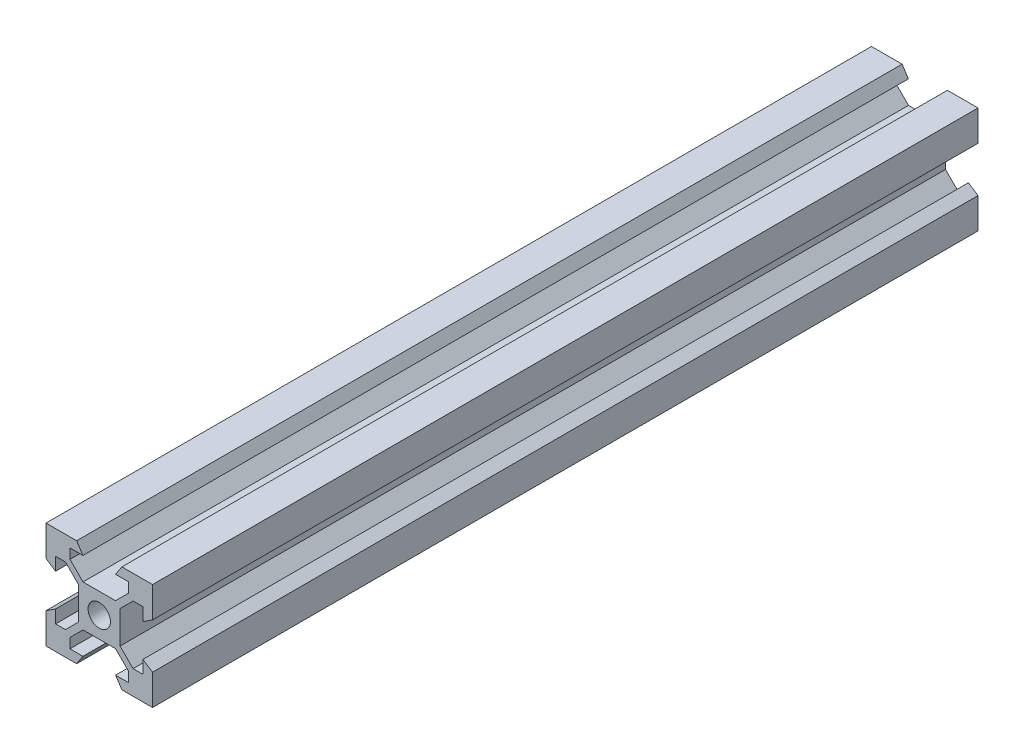
from build123d import *

# Parameters (mm, degrees)
SKETCH1_R           = 2.1
BOSS_EXTRUDE1_DEPTH = 155


with BuildPart() as part:
    # Sketch1 → Boss-Extrude1 (new body)
    with BuildSketch(Plane.XY):
        Polygon((-10, 10), (-4.25, 10), (-3.065, 8.2), (-5.5, 8.2), (-5.5, 6.348528137), (-3.051471863, 3.9), (0, 3.9), (3.051471863, 3.9), (5.5, 6.348528137), (5.5, 8.2), (3.065, 8.2), (4.25, 10), (10, 10), (10, 4.25), (8.2, 3.065), (8.2, 5.5), (6.348528137, 5.5), (3.9, 3.051471863), (3.9, 0), (3.9, -3.051471863), (6.348528137, -5.5), (8.2, -5.5), (8.2, -3.065), (10, -4.25), (10, -10), (4.25, -10), (3.065, -8.2), (5.5, -8.2), (5.5, -6.348528137), (3.051471863, -3.9), (0, -3.9), (-3.051471863, -3.9), (-5.5, -6.348528137), (-5.5, -8.2), (-3.065, -8.2), (-4.25, -10), (-10, -10), (-10, -4.25), (-8.2, -3.065), (-8.2, -5.5), (-6.348528137, -5.5), (-3.9, -3.051471863), (-3.9, 0), (-3.9, 3.051471863), (-6.348528137, 5.5), (-8.2, 5.5), (-8.2, 3.065), (-10, 4.25), align=None)
        Circle(SKETCH1_R, mode=Mode.SUBTRACT)
    extrude(amount=BOSS_EXTRUDE1_DEPTH)


solid = part.part
